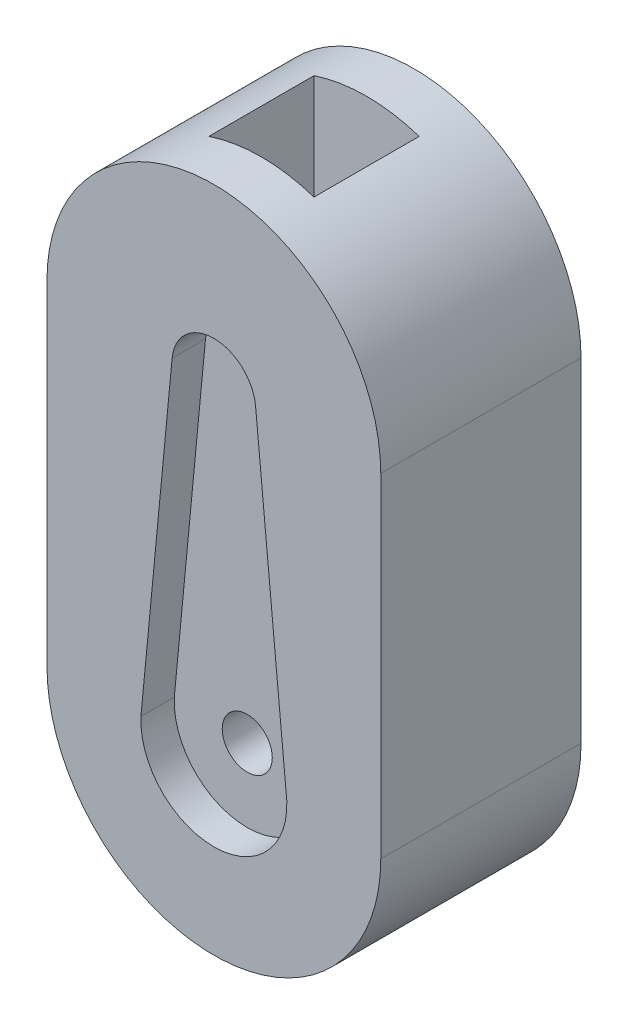
from build123d import *

# Parameters (mm, degrees)
BOSS_EXTRUDE1_DEPTH = 12
SKETCH4_R           = 1.5
CUT_EXTRUDE2_DEPTH  = 34.823069051
CUT_EXTRUDE1_DEPTH  = 2
SKETCH6_W           = 6.3
SKETCH6_H           = 6.3
CUT_EXTRUDE3_DEPTH  = 30.478805946


with BuildPart() as part:
    # Sketch1 → Boss-Extrude1 (new body)
    with BuildSketch(Plane.XY):
        with BuildLine():
            Line((10, 20), (10, 0))
            ThreePointArc((10, 0), (0, -10), (-10, 0))
            Line((-10, 0), (-10, 20))
            ThreePointArc((-10, 20), (0, 30), (10, 20))
        make_face()
    extrude(amount=-BOSS_EXTRUDE1_DEPTH)

    # Sketch4 → Cut-Extrude2 (cut, through all)
    with BuildSketch(Plane.XY):
        Circle(SKETCH4_R)
    extrude(amount=-CUT_EXTRUDE2_DEPTH, mode=Mode.SUBTRACT)

    # Sketch2 → Cut-Extrude1 (cut)
    with BuildSketch(Plane.XY):
        with BuildLine():
            Line((-2.5, 19.73937205), (-4.37, 0.209105237))
            ThreePointArc((-4.37, 0.209105237), (-0.209105237, -4.37), (4.37, -0.209105237))
            ThreePointArc((4.37, -0.209105237), (4.375, 0), (4.37, 0.209105237))
            Line((4.37, 0.209105237), (2.5, 19.73937205))
            ThreePointArc((2.5, 19.73937205), (0, 22.01143365), (-2.5, 19.73937205))
        make_face()
    extrude(amount=-CUT_EXTRUDE1_DEPTH, mode=Mode.SUBTRACT)

    # Sketch6 → Cut-Extrude3 (cut, through all)
    with BuildSketch(Plane(origin=(0, 5, 0), x_dir=(-1, 0, 0), z_dir=(0, -1, 0))):
        with Locations((0, 6)):
            Rectangle(SKETCH6_W, SKETCH6_H)
    extrude(amount=-CUT_EXTRUDE3_DEPTH, mode=Mode.SUBTRACT)


solid = part.part
